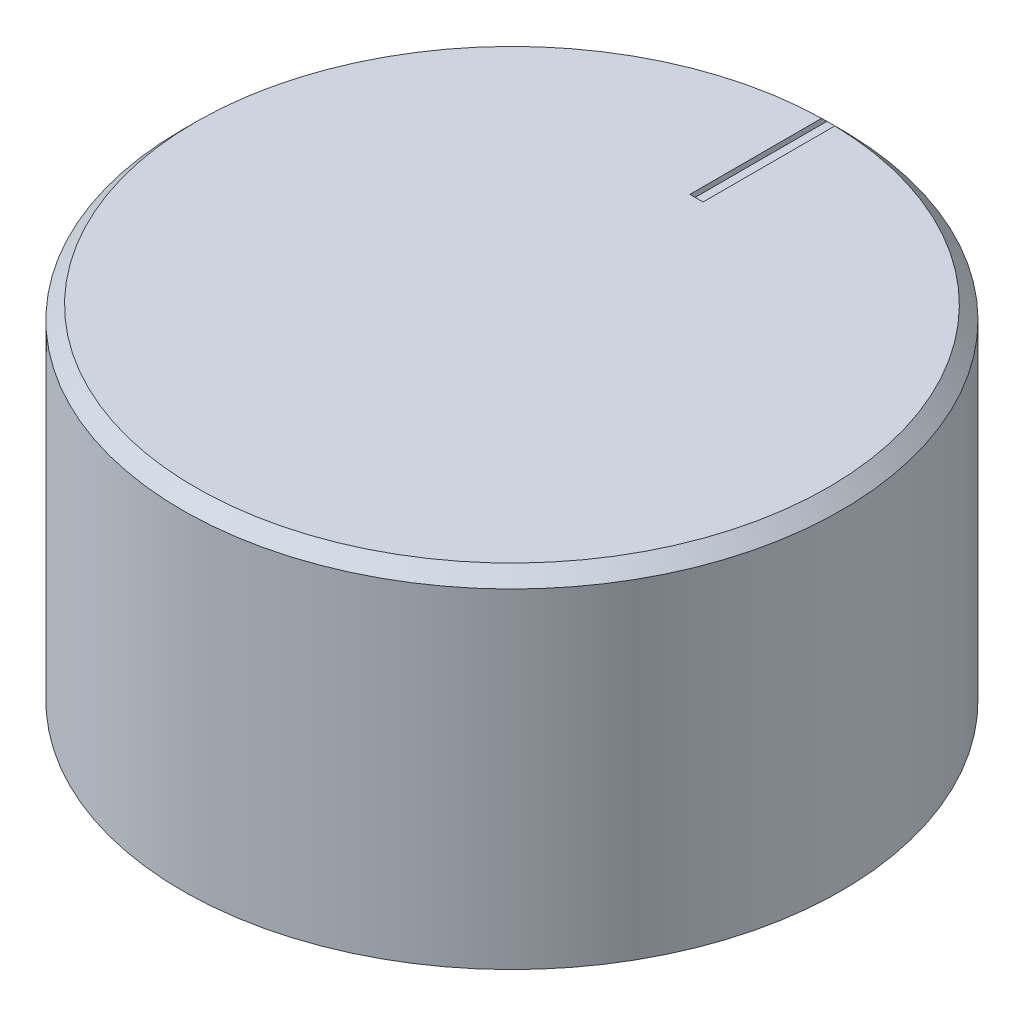
from build123d import *

# Parameters (mm, degrees)
CROQUIS1_W                        = 12.5
CROQUIS1_H                        = 13
CORTAR_EXTRUIR1_START             = -0.2
CORTAR_EXTRUIR1_DEPTH             = 0.2
DI_METRO_DE_TALADRO_5_0_5_1_D     = 5
DI_METRO_DE_TALADRO_5_0_5_1_DEPTH = 9
CHAFL_N1_SIZE                     = 0.2
CROQUIS5_R                        = 2.5
SALIENTE_EXTRUIR1_DEPTH           = 10


with BuildPart() as part:
    # Croquis1 → Revolución1 (revolve)
    with BuildSketch(Plane(origin=(0, 0, 0), x_dir=(-1, 0, 0), z_dir=(0, 0, -1)), mode=Mode.PRIVATE) as revoluci_n1_sk:
        with Locations((-6.25, 6.5)):
            Rectangle(CROQUIS1_W, CROQUIS1_H)
    revolve(revoluci_n1_sk.sketch.rotate(Axis((0, 0, 0), (0, 1, 0)), 180), axis=Axis((0, 0, 0), (0, 1, 0)))

    # Croquis2 → Cortar-Extruir1 (cut)
    with BuildSketch(Plane(origin=(0, 13, 0), x_dir=(-1, 0, 0), z_dir=(0, 1, 0)).offset(CORTAR_EXTRUIR1_START)):
        with BuildLine():
            Line((0.25, -12.49749975), (0.25, -7))
            Line((0.25, -7), (-0.25, -7))
            Line((-0.25, -7), (-0.25, -12.49749975))
            ThreePointArc((-0.25, -12.49749975), (0, -12.5), (0.25, -12.49749975))
        make_face()
    extrude(amount=CORTAR_EXTRUIR1_DEPTH, mode=Mode.SUBTRACT)

    # Diámetro de taladro Ø5.0 (5)1
    with Locations(Plane(origin=(0, 0, 0), x_dir=(-1, 0, 0), z_dir=(0, -1, 0))):
        with Locations((0, 0)):
            Hole(DI_METRO_DE_TALADRO_5_0_5_1_D / 2, depth=DI_METRO_DE_TALADRO_5_0_5_1_DEPTH)

    # Chaflán1
    chafl_n1_edges = [part.edges().sort_by_distance(p)[0] for p in [
        (8.75, 13, 8.926785536),
    ]]
    chamfer(chafl_n1_edges, length=CHAFL_N1_SIZE)

    # Croquis5 → Saliente-Extruir1 (add)
    with BuildSketch(Plane(origin=(0, 13, 0), x_dir=(-1, 0, 0), z_dir=(0, 1, 0))):
        with BuildLine():
            Line((0.25, -7), (-0.25, -7))
            Line((-0.25, -7), (-0.25, -12.49749975))
            ThreePointArc((-0.25, -12.49749975), (0, 12.5), (0.25, -12.49749975))
            Line((0.25, -12.49749975), (0.25, -7))
        make_face()
        with Locations(Location((0, 0, 0), (0, 0, 270))):
            Circle(CROQUIS5_R, mode=Mode.SUBTRACT)
    extrude(amount=-SALIENTE_EXTRUIR1_DEPTH)

    # Chaflán2: read off the stored shape, not the designer's step
    # Chaflán2 outline → Chaflán2 (revolve, cut)
    with BuildSketch(Plane.XY):
        Polygon((12.5, 13), (12, 13), (12.5, 12.5), align=None)
    revolve(axis=Axis((0, 0, 0), (0, 1, 0)), mode=Mode.SUBTRACT)


solid = part.part
